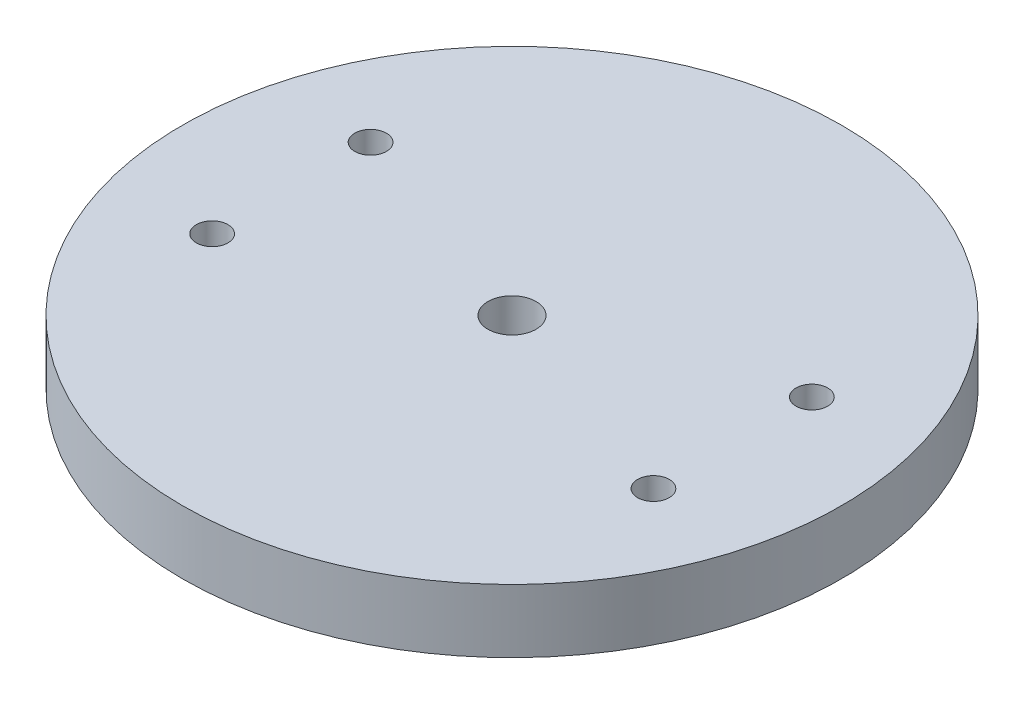
from build123d import *

# Parameters (mm, degrees)
SKETCH1_R               = 66.04
BOSS_EXTRUDE1_DEPTH     = 12.7
CUT_EXTRUDE1_DEPTH      = 95.254194602
CUT_EXTRUDE1_DEPTH_BACK = 95.254194602
SKETCH2_R               = 3.175
SKETCH4_R               = 4.826
CUT_EXTRUDE2_DEPTH      = 95.254194602


with BuildPart() as part:
    # Sketch1 → Boss-Extrude1 (new body)
    with BuildSketch(Plane(origin=(0, 0, 0), x_dir=(1, 0, 0), z_dir=(0, 1, 0))):
        Circle(SKETCH1_R)
    extrude(amount=BOSS_EXTRUDE1_DEPTH)

    # Sketch2 → Cut-Extrude1 (cut, two sides: drawn at the far end of the back side and taken through both)
    with BuildSketch(Plane(origin=(0, 12.7, 0), x_dir=(1, 0, 0), z_dir=(0, 1, 0)).offset(-CUT_EXTRUDE1_DEPTH_BACK)):
        with Locations((-44.214813621, 15.875)):
            Circle(SKETCH2_R)
        with Locations((-44.214813621, -15.875)):
            Circle(SKETCH2_R)
        with Locations((44.214813621, -15.875)):
            Circle(SKETCH2_R)
        with Locations((44.214813621, 15.875)):
            Circle(SKETCH2_R)
    extrude(amount=CUT_EXTRUDE1_DEPTH + CUT_EXTRUDE1_DEPTH_BACK, mode=Mode.SUBTRACT)

    # Sketch4 → Cut-Extrude2 (cut, through all)
    with BuildSketch(Plane.XZ):
        Circle(SKETCH4_R)
    extrude(amount=-CUT_EXTRUDE2_DEPTH, mode=Mode.SUBTRACT)


solid = part.part
